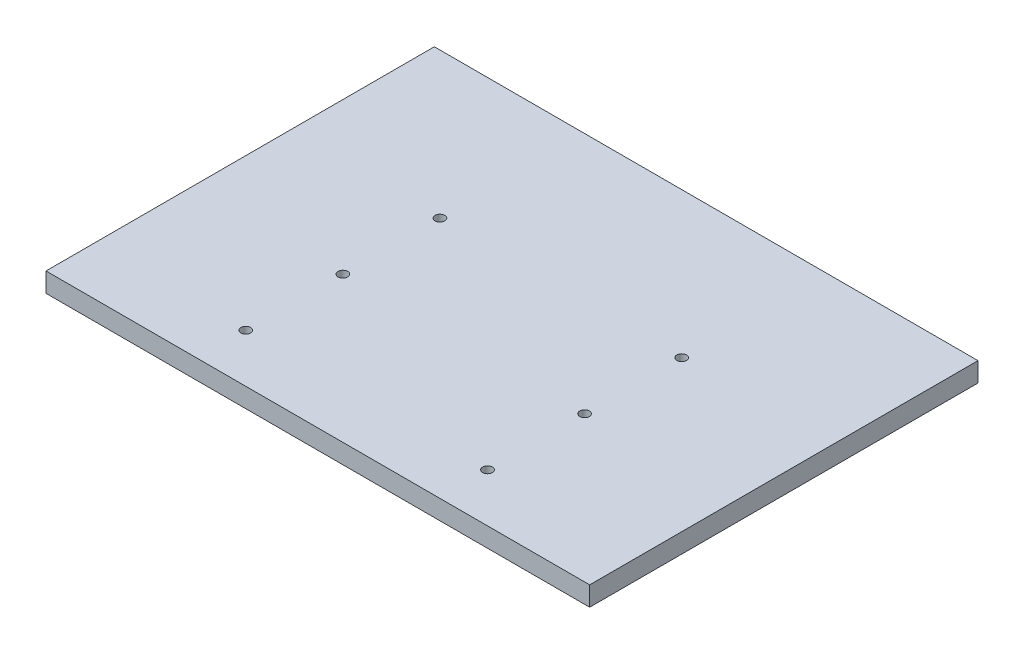
from build123d import *

# Parameters (mm, degrees)
SKETCH1_W           = 711.2
SKETCH1_H           = 508
BOSS_EXTRUDE1_DEPTH = 25.4
SKETCH3_R           = 6.35
CUT_EXTRUDE1_DEPTH  = 662.612368604


with BuildPart() as part:
    # Sketch1 → Boss-Extrude1 (new body)
    with BuildSketch(Plane(origin=(0, 0, 0), x_dir=(1, 0, 0), z_dir=(0, 1, 0))):
        with Locations((179.878427205, -133.748140276)):
            Rectangle(SKETCH1_W, SKETCH1_H)
    extrude(amount=BOSS_EXTRUDE1_DEPTH)

    # Sketch3 → Cut-Extrude1 (cut, through all)
    with BuildSketch(Plane(origin=(0, 25.4, 0), x_dir=(1, 0, 0), z_dir=(0, 1, 0))):
        with Locations((22.119027205, -324.248140276)):
            Circle(SKETCH3_R)
        with Locations((338.349027205, -324.248140276)):
            Circle(SKETCH3_R)
        with Locations((22.119027205, -197.248140276)):
            Circle(SKETCH3_R)
        with Locations((22.119027205, -70.248140276)):
            Circle(SKETCH3_R)
        with Locations((338.349027205, -70.248140276)):
            Circle(SKETCH3_R)
        with Locations((338.349027205, -197.248140276)):
            Circle(SKETCH3_R)
    extrude(amount=-CUT_EXTRUDE1_DEPTH, mode=Mode.SUBTRACT)


solid = part.part
